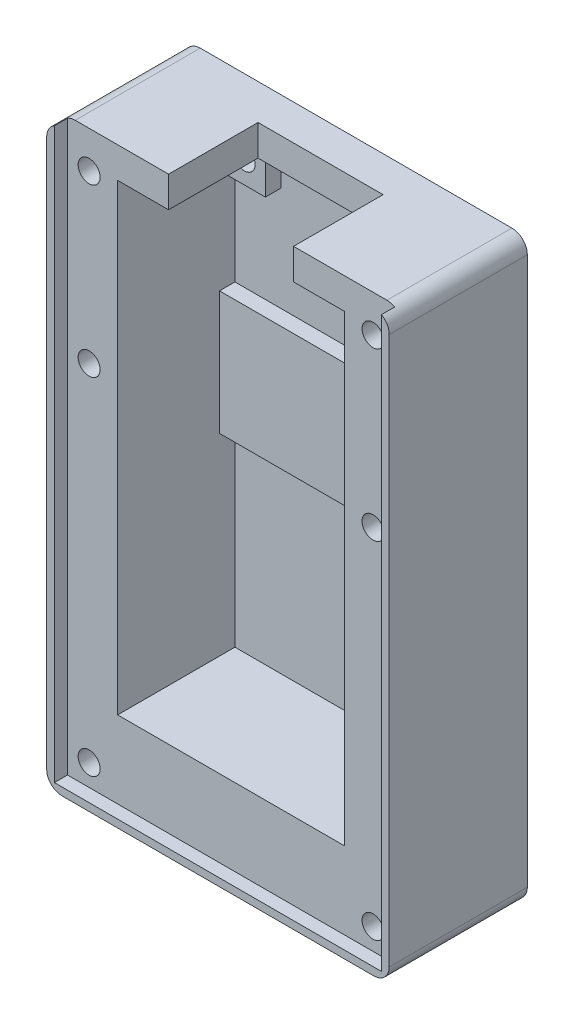
from build123d import *

# Parameters (mm, degrees)
SKETCH_2_R            = 1.425
EXTRUDE_1_DEPTH       = 2
SKETCH_2_3_R          = 1.425
EXTRUDE_2_DEPTH       = 2
EXTRUDE_START         = -1
EXTRUDE_3_DEPTH       = 1
EXTRUDE_4_DEPTH       = 1
SKETCH_2_6_W          = 8.1
SKETCH_2_6_H          = 3
EXTRUDE_5_DEPTH       = 3.6
EXTRUDE_6_DEPTH       = 15.2
EXTRUDE_6_DEPTH_BACK  = 1
SKETCH_2_7_R          = 1.425
SKETCH_2_8_W          = 29.4
SKETCH_2_8_H          = 25
EXTRUDE_7_DEPTH       = 1
SKETCH_2_9_W          = 29.4
SKETCH_2_9_H          = 16
EXTRUDE_8_DEPTH       = 1
SKETCH_2_10_W         = 29.4
SKETCH_2_10_H         = 16
EXTRUDE_9_DEPTH       = 2
SKETCH_2_11_W         = 8.1
SKETCH_2_11_H         = 3
SKETCH_2_11_R         = 1.425
EXTRUDE_10_DEPTH      = 1
EXTRUDE_12_DEPTH      = 16.9
EXTRUDE_12_DEPTH_BACK = 1
SKETCH_2_24_W         = 1
SKETCH_2_24_H         = 1
EXTRUDE_13_DEPTH      = 16.9
SKETCH_2_25_W         = 13.1
SKETCH_2_25_H         = 1
EXTRUDE_14_DEPTH      = 15.2
SKETCH_2_26_W         = 8.1
SKETCH_2_26_H         = 1
EXTRUDE_15_DEPTH      = 3.6
SKETCH_2_28_W         = 1
SKETCH_2_28_H         = 1
SKETCH_2_28_W_2       = 13.1
SKETCH_2_28_W_3       = 8.1
EXTRUDE_16_DEPTH      = 1
FILLET_1_R            = 2
SKETCH_4_R            = 2.15
SKETCH_4_R_2          = 1.425
CUT_EXTRUDE_1_DEPTH   = 2.1


# Read off the part's stored shape, not the designer's step: 凸台-拉伸3
with BuildPart() as part:
    # 草图2 → 凸台-拉伸1 (new body)
    with BuildSketch(Plane.XY):
        Polygon((-31.74588875, 30.116039863), (-37.24588875, 30.116039863), (-37.69588875, 30.116039863), (-37.69588875, 24.616039863), (-37.24588875, 24.616039863), (-31.74588875, 24.616039863), align=None)
        with Locations((-34.49588875, 27.616039863)):
            Circle(SKETCH_2_R, mode=Mode.SUBTRACT)
    extrude(amount=EXTRUDE_1_DEPTH)



with BuildPart() as body_2:
    # 草图2<3> → 凸台-拉伸2 (new body)
    with BuildSketch(Plane.XY):
        Polygon((-8.74588875, 30.116039863), (-14.24588875, 30.116039863), (-14.24588875, 24.616039863), (-8.74588875, 24.616039863), (-8.29588875, 24.616039863), (-8.29588875, 30.116039863), align=None)
        with Locations((-11.49588875, 27.616039863)):
            Circle(SKETCH_2_3_R, mode=Mode.SUBTRACT)
    extrude(amount=EXTRUDE_2_DEPTH)


with BuildPart() as body_3:
    # 凸台-拉伸3 outline → 凸台-拉伸3 (new body)
    with BuildSketch(Plane.XY.offset(EXTRUDE_START)):
        Polygon((-37.69588875, 24.616039863), (-37.69588875, 11.116039863), (-22.99588875, 11.116039863), (-22.99588875, 30.116039863), (-31.74588875, 30.116039863), (-31.74588875, 24.616039863), align=None)
    extrude(amount=EXTRUDE_3_DEPTH)

    # 草图2<5> → 凸台-拉伸4 (add)
    with BuildSketch(Plane.XY):
        Polygon((-22.99588875, 30.116039863), (-22.99588875, 28.589280798), (-22.99588875, 11.116039863), (-8.29588875, 11.116039863), (-8.29588875, 24.616039863), (-8.74588875, 24.616039863), (-14.24588875, 24.616039863), (-14.24588875, 30.116039863), (-14.89588875, 30.116039863), align=None)
    extrude(amount=-EXTRUDE_4_DEPTH)

    # 草图2<7> → 凸台-拉伸6 (add, two sides: drawn at the far end of the back side and taken through both)
    with BuildSketch(Plane.XY.offset(-EXTRUDE_6_DEPTH_BACK)):
        Polygon((-31.74588875, 30.116039863), (-31.09588875, 30.116039863), (-31.09588875, 33.116039863), (-44.19588875, 33.116039863), (-44.19588875, 11.116039863), (-44.19588875, -29.883960137), (-44.19588875, -39.883960137), (-1.79588875, -39.883960137), (-1.79588875, -29.883960137), (-1.79588875, 11.116039863), (-1.79588875, 33.116039863), (-14.89588875, 33.116039863), (-14.89588875, 30.116039863), (-14.24588875, 30.116039863), (-8.74588875, 30.116039863), (-8.29588875, 30.116039863), (-8.29588875, 24.616039863), (-8.29588875, 11.116039863), (-8.29588875, -4.883960137), (-8.29588875, -29.883960137), (-37.69588875, -29.883960137), (-37.69588875, -4.883960137), (-37.69588875, 11.116039863), (-37.69588875, 24.616039863), (-37.69588875, 30.116039863), (-37.24588875, 30.116039863), align=None)
        with Locations(Location((-41.39588875, -37.083960137, 0), (0, 0, 180))):
            Circle(SKETCH_2_7_R, mode=Mode.SUBTRACT)
        with Locations(Location((-4.59588875, -37.083960137, 0), (0, 0, 180))):
            Circle(SKETCH_2_7_R, mode=Mode.SUBTRACT)
        with Locations(Location((-41.39588875, 7.716039863, 0), (0, 0, 180))):
            Circle(SKETCH_2_7_R, mode=Mode.SUBTRACT)
        with Locations(Location((-41.39588875, 29.316039863, 0), (0, 0, 180))):
            Circle(SKETCH_2_7_R, mode=Mode.SUBTRACT)
        with Locations(Location((-4.59588875, 7.716039863, 0), (0, 0, 180))):
            Circle(SKETCH_2_7_R, mode=Mode.SUBTRACT)
        with Locations(Location((-4.59588875, 29.316039863, 0), (0, 0, 180))):
            Circle(SKETCH_2_7_R, mode=Mode.SUBTRACT)
    extrude(amount=EXTRUDE_6_DEPTH + EXTRUDE_6_DEPTH_BACK)

    # 草图2<8> → 凸台-拉伸7 (add)
    with BuildSketch(Plane.XY):
        with Locations((-22.99588875, -17.383960137)):
            Rectangle(SKETCH_2_8_W, SKETCH_2_8_H)
    extrude(amount=-EXTRUDE_7_DEPTH)

    # 草图2<9> → 凸台-拉伸8 (add)
    with BuildSketch(Plane.XY):
        with Locations((-22.99588875, 3.116039863)):
            Rectangle(SKETCH_2_9_W, SKETCH_2_9_H)
    extrude(amount=-EXTRUDE_8_DEPTH)

    # 草图2<10> → 凸台-拉伸9 (add)
    with BuildSketch(Plane.XY):
        with Locations((-22.99588875, 3.116039863)):
            Rectangle(SKETCH_2_10_W, SKETCH_2_10_H)
    extrude(amount=EXTRUDE_9_DEPTH)


with BuildPart() as body_4:
    # 草图2<6> → 凸台-拉伸5 (new body)
    with BuildSketch(Plane.XY):
        with Locations((-27.04588875, 31.616039863)):
            Rectangle(SKETCH_2_6_W, SKETCH_2_6_H)
        with Locations((-18.94588875, 31.616039863)):
            Rectangle(SKETCH_2_6_W, SKETCH_2_6_H)
    extrude(amount=EXTRUDE_5_DEPTH)


with BuildPart() as part_1:
    add(part.part)

    add(body_2.part)  # 凸台-拉伸10 merges body 2

    add(body_3.part)  # 凸台-拉伸10 merges body 3

    add(body_4.part)  # 凸台-拉伸10 merges body 4
    # 草图2<11> → 凸台-拉伸10 (add)
    # profile 1 of 4: a face of its own
    with BuildSketch(Plane.XY.offset(EXTRUDE_START)):
        with Locations((-18.94588875, 31.616039863)):
            Rectangle(SKETCH_2_11_W, SKETCH_2_11_H)
    # profile 2 of 4: a face of its own
    with BuildSketch(Plane.XY.offset(EXTRUDE_START)):
        with Locations((-27.04588875, 31.616039863)):
            Rectangle(SKETCH_2_11_W, SKETCH_2_11_H)
    # profile 3 of 4: a face of its own
    with BuildSketch(Plane.XY.offset(EXTRUDE_START)):
        Polygon((-8.74588875, 30.116039863), (-14.24588875, 30.116039863), (-14.24588875, 24.616039863), (-8.74588875, 24.616039863), (-8.29588875, 24.616039863), (-8.29588875, 30.116039863), align=None)
        with Locations((-11.49588875, 27.616039863)):
            Circle(SKETCH_2_11_R, mode=Mode.SUBTRACT)
    # profile 4 of 4: a face of its own
    with BuildSketch(Plane.XY.offset(EXTRUDE_START)):
        Polygon((-31.74588875, 24.616039863), (-31.74588875, 30.116039863), (-37.24588875, 30.116039863), (-37.69588875, 30.116039863), (-37.69588875, 24.616039863), (-37.24588875, 24.616039863), align=None)
        with Locations((-34.49588875, 27.616039863)):
            Circle(SKETCH_2_11_R, mode=Mode.SUBTRACT)
    extrude(amount=EXTRUDE_10_DEPTH)

    # 草图2<22> → 凸台-拉伸12 (add, two sides: drawn at the far end of the back side and taken through both)
    with BuildSketch(Plane.XY.offset(-EXTRUDE_12_DEPTH_BACK)):
        Polygon((-44.19588875, 11.116039863), (-44.19588875, 33.116039863), (-45.19588875, 33.116039863), (-45.19588875, -40.883960137), (-44.19588875, -40.883960137), (-0.79588875, -40.883960137), (-0.79588875, 33.116039863), (-1.79588875, 33.116039863), (-1.79588875, 11.116039863), (-1.79588875, -29.883960137), (-1.79588875, -39.883960137), (-44.19588875, -39.883960137), (-44.19588875, -29.883960137), align=None)
    extrude(amount=EXTRUDE_12_DEPTH + EXTRUDE_12_DEPTH_BACK)

    # 草图2<24> → 凸台-拉伸13 (add)
    with BuildSketch(Plane.XY):
        with Locations((-44.69588875, 33.616039863)):
            Rectangle(SKETCH_2_24_W, SKETCH_2_24_H)
        with Locations((-1.29588875, 33.616039863)):
            Rectangle(SKETCH_2_24_W, SKETCH_2_24_H)
    extrude(amount=EXTRUDE_13_DEPTH)

    # 草图2<25> → 凸台-拉伸14 (add)
    with BuildSketch(Plane.XY):
        with Locations((-37.64588875, 33.616039863)):
            Rectangle(SKETCH_2_25_W, SKETCH_2_25_H)
        with Locations((-8.34588875, 33.616039863)):
            Rectangle(SKETCH_2_25_W, SKETCH_2_25_H)
    extrude(amount=EXTRUDE_14_DEPTH)

    # 草图2<26> → 凸台-拉伸15 (add)
    with BuildSketch(Plane.XY):
        with Locations((-27.04588875, 33.616039863)):
            Rectangle(SKETCH_2_26_W, SKETCH_2_26_H)
        with Locations((-18.94588875, 33.616039863)):
            Rectangle(SKETCH_2_26_W, SKETCH_2_26_H)
    extrude(amount=EXTRUDE_15_DEPTH)

    # 草图2<28> → 凸台-拉伸16 (add)
    with BuildSketch(Plane.XY):
        with Locations((-1.29588875, 33.616039863)):
            Rectangle(SKETCH_2_28_W, SKETCH_2_28_H)
        with Locations((-8.34588875, 33.616039863)):
            Rectangle(SKETCH_2_28_W_2, SKETCH_2_28_H)
        with Locations((-18.94588875, 33.616039863)):
            Rectangle(SKETCH_2_28_W_3, SKETCH_2_28_H)
        with Locations((-27.04588875, 33.616039863)):
            Rectangle(SKETCH_2_28_W_3, SKETCH_2_28_H)
        with Locations((-37.64588875, 33.616039863)):
            Rectangle(SKETCH_2_28_W_2, SKETCH_2_28_H)
        with Locations((-44.69588875, 33.616039863)):
            Rectangle(SKETCH_2_28_W, SKETCH_2_28_H)
    extrude(amount=-EXTRUDE_16_DEPTH)

    # 圆角1
    fillet_1_edges = [part_1.edges().sort_by_distance(p)[0] for p in [
        (-0.79588875, -40.883960137, 7.95),
        (-45.19588875, -40.883960137, 7.95),
        (-0.79588875, 34.116039863, 7.95),
        (-45.19588875, 34.116039863, 7.95),
    ]]
    fillet(fillet_1_edges, radius=FILLET_1_R)

    # 草图4 → 切除-拉伸1 (cut)
    # profile 1 of 6: a face of its own
    with BuildSketch(Plane(origin=(0, 0, -1), x_dir=(-1, 0, 0), z_dir=(0, 0, -1))):
        with Locations((4.59588875, 7.716039863)):
            Circle(SKETCH_4_R)
        with Locations((4.59588875, 7.716039863)):
            Circle(SKETCH_4_R_2, mode=Mode.SUBTRACT)
    # profile 2 of 6: a face of its own
    with BuildSketch(Plane(origin=(0, 0, -1), x_dir=(-1, 0, 0), z_dir=(0, 0, -1))):
        with Locations((4.59588875, 29.316039863)):
            Circle(SKETCH_4_R)
        with Locations((4.59588875, 29.316039863)):
            Circle(SKETCH_4_R_2, mode=Mode.SUBTRACT)
    # profile 3 of 6: a face of its own
    with BuildSketch(Plane(origin=(0, 0, -1), x_dir=(-1, 0, 0), z_dir=(0, 0, -1))):
        with Locations((41.39588875, 29.316039863)):
            Circle(SKETCH_4_R)
        with Locations((41.39588875, 29.316039863)):
            Circle(SKETCH_4_R_2, mode=Mode.SUBTRACT)
    # profile 4 of 6: a face of its own
    with BuildSketch(Plane(origin=(0, 0, -1), x_dir=(-1, 0, 0), z_dir=(0, 0, -1))):
        with Locations((41.39588875, 7.716039863)):
            Circle(SKETCH_4_R)
        with Locations((41.39588875, 7.716039863)):
            Circle(SKETCH_4_R_2, mode=Mode.SUBTRACT)
    # profile 5 of 6: a face of its own
    with BuildSketch(Plane(origin=(0, 0, -1), x_dir=(-1, 0, 0), z_dir=(0, 0, -1))):
        with Locations((4.59588875, -37.083960137)):
            Circle(SKETCH_4_R)
        with Locations((4.59588875, -37.083960137)):
            Circle(SKETCH_4_R_2, mode=Mode.SUBTRACT)
    # profile 6 of 6: a face of its own
    with BuildSketch(Plane(origin=(0, 0, -1), x_dir=(-1, 0, 0), z_dir=(0, 0, -1))):
        with Locations((41.39588875, -37.083960137)):
            Circle(SKETCH_4_R)
        with Locations((41.39588875, -37.083960137)):
            Circle(SKETCH_4_R_2, mode=Mode.SUBTRACT)
    extrude(amount=-CUT_EXTRUDE_1_DEPTH, mode=Mode.SUBTRACT)


solid = part_1.part
